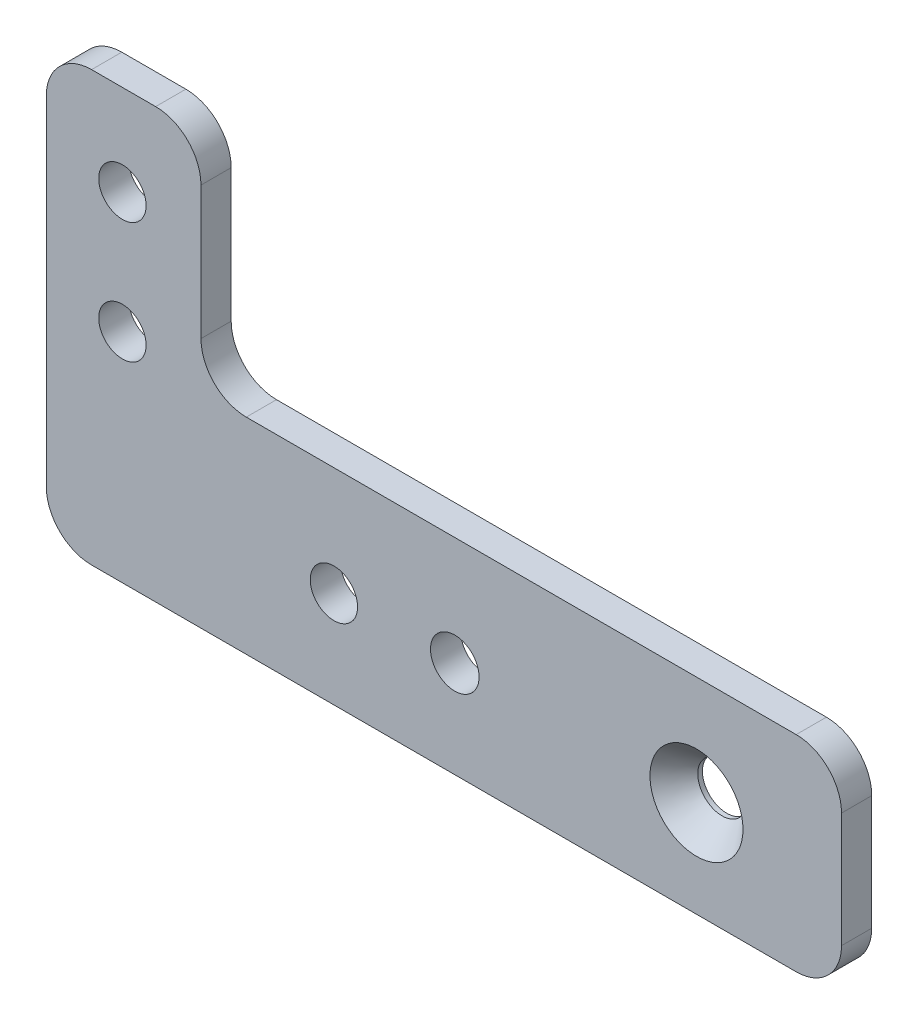
from build123d import *

# Parameters (mm, degrees)
SKETCH1_R                                       = 2.4892
SKETCH1_R_2                                     = 2.5527
BOSS_EXTRUDE1_DEPTH                             = 3.175
FILLET1_R                                       = 4.7625
CSK_FOR_10_FLAT_HEAD_MACHINE_SCREW1_D           = 5.1054
CSK_FOR_10_FLAT_HEAD_MACHINE_SCREW1_DEPTH       = 19.05
CSK_FOR_10_FLAT_HEAD_MACHINE_SCREW1_CSINK_D     = 9.779
CSK_FOR_10_FLAT_HEAD_MACHINE_SCREW1_CSINK_ANGLE = 82
CSK_FOR_10_FLAT_HEAD_MACHINE_SCREW1_TIP         = 1.533816902


with BuildPart() as part:
    # Sketch1 → Boss-Extrude1 (new body)
    with BuildSketch(Plane.XY):
        Polygon((-37.846, 23.8125), (-37.846, -21.2725), (45.72, -21.2725), (45.72, 0.3175), (-21.59, 0.3175), (-21.59, 23.8125), align=None)
        with Locations((-7.62, -11.1125)):
            Circle(SKETCH1_R, mode=Mode.SUBTRACT)
        with Locations((5.08, -11.1125)):
            Circle(SKETCH1_R_2, mode=Mode.SUBTRACT)
        with Locations((30.48, -11.1125)):
            Circle(SKETCH1_R_2, mode=Mode.SUBTRACT)
        with Locations((-29.845, 1.5875)):
            Circle(SKETCH1_R, mode=Mode.SUBTRACT)
        with Locations((-29.845, 14.2875)):
            Circle(SKETCH1_R, mode=Mode.SUBTRACT)
    extrude(amount=BOSS_EXTRUDE1_DEPTH)

    # Fillet1
    fillet1_edges = [part.edges().sort_by_distance(p)[0] for p in [
        (-37.846, 23.8125, 1.5875),
        (-21.59, 23.8125, 1.5875),
        (-21.59, 0.3175, 1.5875),
        (45.72, 0.3175, 1.5875),
        (45.72, -21.2725, 1.5875),
        (-37.846, -21.2725, 1.5875),
    ]]
    fillet(fillet1_edges, radius=FILLET1_R)

    # CSK for #10 Flat Head Machine Screw1
    with Locations(Plane.XY.offset(3.175)):
        with Locations((30.48, -11.1125)):
            CounterSinkHole(CSK_FOR_10_FLAT_HEAD_MACHINE_SCREW1_D / 2, CSK_FOR_10_FLAT_HEAD_MACHINE_SCREW1_CSINK_D / 2, depth=CSK_FOR_10_FLAT_HEAD_MACHINE_SCREW1_DEPTH, counter_sink_angle=CSK_FOR_10_FLAT_HEAD_MACHINE_SCREW1_CSINK_ANGLE)
            with Locations((0, 0, -(CSK_FOR_10_FLAT_HEAD_MACHINE_SCREW1_DEPTH + CSK_FOR_10_FLAT_HEAD_MACHINE_SCREW1_TIP / 2))):  # 118° drill point
                Cone(0, CSK_FOR_10_FLAT_HEAD_MACHINE_SCREW1_D / 2, CSK_FOR_10_FLAT_HEAD_MACHINE_SCREW1_TIP, mode=Mode.SUBTRACT)


solid = part.part
